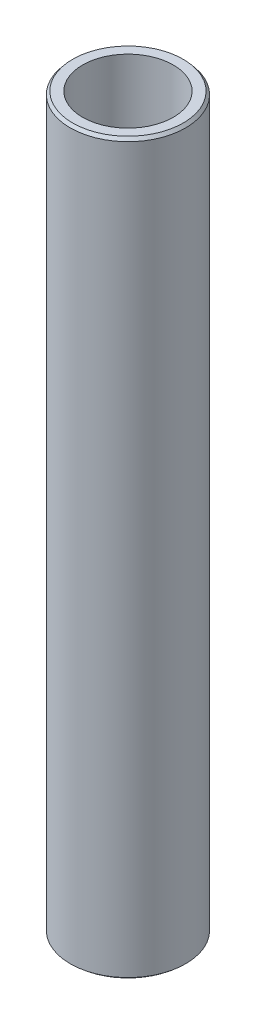
from build123d import *
from OCP.BRepFilletAPI import BRepFilletAPI_MakeChamfer

# Parameters (mm, degrees)
SKETCH1_R           = 47.5
BOSS_EXTRUDE1_DEPTH = 600
SKETCH2_R           = 37.317815129
CUT_EXTRUDE1_DEPTH  = 604.748706003
CHAMFER1_SIZE       = 2.453131886
CHAMFER1_SIZE2      = 2.032927425


with BuildPart() as part:
    # Sketch1 → Boss-Extrude1 (new body)
    with BuildSketch(Plane(origin=(0, 0, 0), x_dir=(1, 0, 0), z_dir=(0, 1, 0))):
        Circle(SKETCH1_R)
    extrude(amount=BOSS_EXTRUDE1_DEPTH)

    # Sketch2 → Cut-Extrude1 (cut, through all)
    with BuildSketch(Plane(origin=(0, 0, 0), x_dir=(1, 0, 0), z_dir=(0, 1, 0))):
        Circle(SKETCH2_R)
    extrude(amount=CUT_EXTRUDE1_DEPTH, mode=Mode.SUBTRACT)

    # Chamfer1: one chamfer whose edges measure the first distance from different faces: ONE call of the kernel's chamfer builder (chamfer() names one face for all edges)
    chamfer1_edges_1 = [part.edges().sort_by_distance(p)[0] for p in [
        (-47.5, 600, 0),
    ]]
    chamfer1_side_1 = [part.faces().sort_by_distance(p)[0] for p in [
        (-47.5, 300, 0),
    ]]
    chamfer1_edges_2 = [part.edges().sort_by_distance(p)[0] for p in [
        (-47.5, 0, 0),
    ]]
    chamfer1_side_2 = [part.faces().sort_by_distance(p)[0] for p in [
        (-46.156497116, 0, 0),
    ]]
    chamfer1 = BRepFilletAPI_MakeChamfer(part.part.solid().wrapped)
    for e in chamfer1_edges_1:
        chamfer1.Add(CHAMFER1_SIZE, CHAMFER1_SIZE2, e.wrapped, chamfer1_side_1[0].wrapped)  # the first distance lies on this face
    for e in chamfer1_edges_2:
        chamfer1.Add(CHAMFER1_SIZE, CHAMFER1_SIZE2, e.wrapped, chamfer1_side_2[0].wrapped)  # the first distance lies on this face
    add(Compound.cast(chamfer1.Shape()), mode=Mode.REPLACE)


solid = part.part
